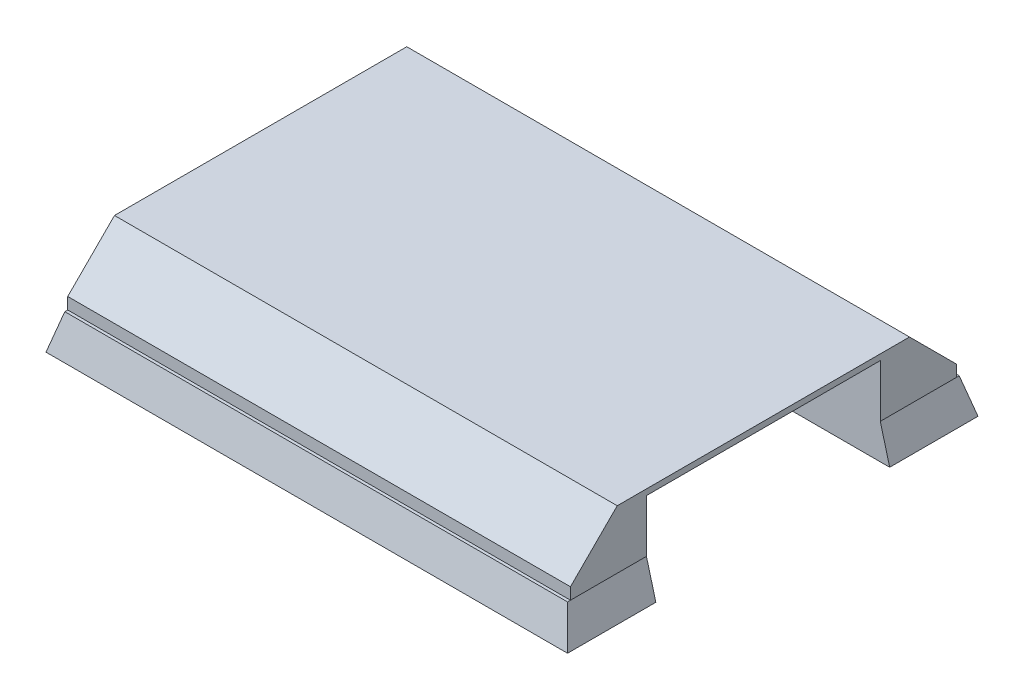
from build123d import *

# Parameters (mm, degrees)
SKETCH_1_W          = 43
SKETCH_1_H          = 33.5
EXTRUDE_1_DEPTH     = 3
EXTRUDE_1_DRAFT     = 15
SKETCH_2_W          = 43
SKETCH_2_H          = 33
EXTRUDE_2_DEPTH     = 5
SKETCH_3_W          = 20
SKETCH_3_H          = 7
CUT_EXTRUDE_1_DEPTH = 39
SKETCH_4_W          = 8
SKETCH_4_H          = 18
CUT_EXTRUDE_2_DEPTH = 1
CHAMFER_1_SIZE      = 1
CHAMFER_2_SIZE      = 6
CHAMFER_3_SIZE      = 4
SKETCH_5_W          = 20
SKETCH_5_H          = 3
CUT_EXTRUDE_3_DEPTH = 48.454342555


with BuildPart() as part:
    # Эскиз1 → Бобышка-Вытянуть1 (with draft: the straight prism first)
    with BuildSketch(Plane(origin=(0, 0, 0), x_dir=(1, 0, 0), z_dir=(0, 1, 0))):
        Rectangle(SKETCH_1_W, SKETCH_1_H)
    extrude(amount=-EXTRUDE_1_DEPTH)
    # Бобышка-Вытянуть1: the draft: its side faces are tilted about the plane it starts from
    extrude_1_sides = [part.faces().sort_by_distance(p)[0] for p in [
        (21.5, -1.5, 0),
        (0, -1.5, -16.75),
        (-21.5, -1.5, 0),
        (0, -1.5, 16.75),
    ]]
    draft(extrude_1_sides, Plane(origin=(0, 0, 0), x_dir=(1, 0, 0), z_dir=(0, 1, 0)), EXTRUDE_1_DRAFT)

    # Эскиз2 → Бобышка-Вытянуть2 (add)
    with BuildSketch(Plane(origin=(0, 0, 0), x_dir=(1, 0, 0), z_dir=(0, 1, 0))):
        Rectangle(SKETCH_2_W, SKETCH_2_H)
    extrude(amount=EXTRUDE_2_DEPTH)

    # Эскиз3 → Вырез-Вытянуть1 (cut)
    with BuildSketch(Plane(origin=(21.5, 0, 0), x_dir=(0, 0, -1), z_dir=(1, 0, 0))):
        Rectangle(SKETCH_3_W, SKETCH_3_H)
    extrude(amount=-CUT_EXTRUDE_1_DEPTH, mode=Mode.SUBTRACT)

    # Эскиз4 → Вырез-Вытянуть2 (cut)
    with BuildSketch(Plane.XZ.offset(-3.5)):
        with Locations((14.5, 0)):
            Rectangle(SKETCH_4_W, SKETCH_4_H)
    extrude(amount=-CUT_EXTRUDE_2_DEPTH, mode=Mode.SUBTRACT)

    # Фаска1
    chamfer_1_edges = [part.edges().sort_by_distance(p)[0] for p in [
        (21.5, 3.5, 0),
    ]]
    chamfer(chamfer_1_edges, length=CHAMFER_1_SIZE)

    # Фаска2
    # the kernel refuses this chamfer: 6 mm, written as the material it takes off along each edge
    with BuildSketch(Plane(origin=(-17.5, -3, -10), x_dir=(0.027495876610586202, 0.9996219169112968, 0), z_dir=(0, 0, 1))) as chamfer_2_piece_1:
        Polygon((CHAMFER_2_SIZE * 0.999621916911, CHAMFER_2_SIZE * 0.0274958766106), (-CHAMFER_2_SIZE * 0.0274958766106, CHAMFER_2_SIZE * 0.999621916911), (0, 0), align=None)
    extrude(amount=20, mode=Mode.SUBTRACT)

    # Фаска3
    chamfer_3_edges = [part.edges().sort_by_distance(p)[0] for p in [
        (0, 5, -16.5),
        (0, 5, 16.5),
    ]]
    chamfer(chamfer_3_edges, length=CHAMFER_3_SIZE)

    # Эскиз5 → Вырез-Вытянуть3 (cut, through all)
    with BuildSketch(Plane.ZY.offset(-21.5)):
        with Locations((0, -1.5)):
            Rectangle(SKETCH_5_W, SKETCH_5_H)
    extrude(amount=-CUT_EXTRUDE_3_DEPTH, mode=Mode.SUBTRACT)


solid = part.part
